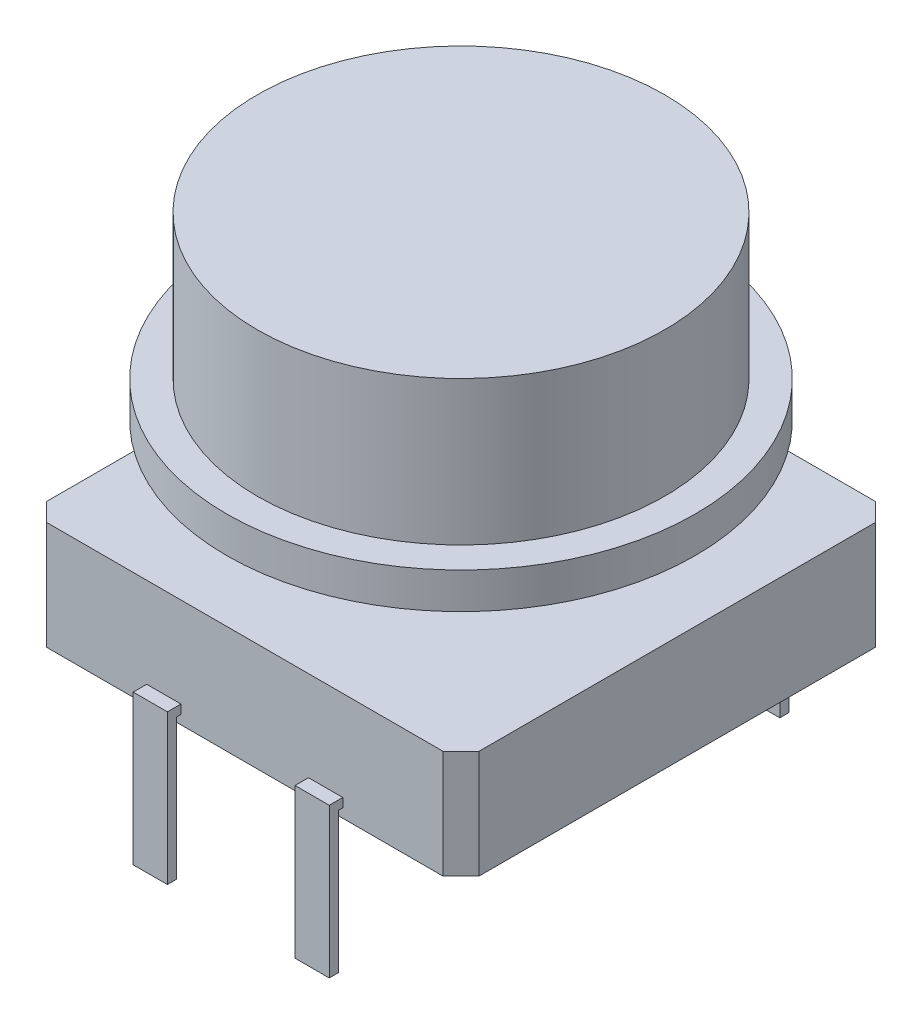
from build123d import *

# Parameters (mm, degrees)
BOSS_EXTRUDE1_DEPTH  = 3
SKETCH2_R            = 3.375
BOSS_EXTRUDE2_DEPTH  = 0.2
SKETCH3_W            = 3.5
SKETCH3_H            = 3.5
BOSS_EXTRUDE3_DEPTH  = 2
SKETCH4_R            = 6.5
BOSS_EXTRUDE4_DEPTH  = 1
SKETCH5_R            = 5.65
BOSS_EXTRUDE5_DEPTH  = 4
BOSS_EXTRUDE6_DEPTH  = 0.95
MIRROR2_COPY_1_DEPTH = 0.95


with BuildPart() as part:
    # Sketch1 → Boss-Extrude1 (new body)
    with BuildSketch(Plane(origin=(0, 0, 0), x_dir=(1, 0, 0), z_dir=(0, 1, 0))):
        Polygon((-5.5, 6), (-6, 5.5), (-6, -5.5), (-5.5, -6), (5.5, -6), (6, -5.5), (6, 5.5), (5.5, 6), align=None)
    extrude(amount=BOSS_EXTRUDE1_DEPTH)

    # Sketch2 → Boss-Extrude2 (add)
    with BuildSketch(Plane(origin=(0, 3, 0), x_dir=(1, 0, 0), z_dir=(0, 1, 0))):
        Circle(SKETCH2_R)
    extrude(amount=BOSS_EXTRUDE2_DEPTH)

    # Sketch3 → Boss-Extrude3 (add)
    with BuildSketch(Plane(origin=(0, 3.2, 0), x_dir=(1, 0, 0), z_dir=(0, 1, 0))):
        Rectangle(SKETCH3_W, SKETCH3_H)
    extrude(amount=BOSS_EXTRUDE3_DEPTH)

    # Sketch4 → Boss-Extrude4 (add)
    with BuildSketch(Plane(origin=(0, 5.2, 0), x_dir=(1, 0, 0), z_dir=(0, 1, 0))):
        Circle(SKETCH4_R)
    extrude(amount=BOSS_EXTRUDE4_DEPTH)

    # Sketch5 → Boss-Extrude5 (add)
    with BuildSketch(Plane(origin=(0, 6.2, 0), x_dir=(1, 0, 0), z_dir=(0, 1, 0))):
        Circle(SKETCH5_R)
    extrude(amount=BOSS_EXTRUDE5_DEPTH)

    # Sketch7 → Boss-Extrude6 (add)
    with BuildSketch(Plane.ZY.offset(2.72)):
        Polygon((6.375, 0.5), (6, 0.5), (6, 0.25), (6.125, 0.25), (6.125, -3.65), (6.375, -3.65), align=None)
    boss_extrude6 = extrude(amount=-BOSS_EXTRUDE6_DEPTH)

    # Mirror1: Boss-Extrude6 across plane
    add(boss_extrude6.mirror(Plane.ZY))

    # Mirror2: Boss-Extrude6 across plane
    add(boss_extrude6.mirror(Plane.XY))

    # Mirror2 copy 1 sketch → Mirror2 copy 1 (add)
    with BuildSketch(Plane(origin=(2.72, 0, 0), x_dir=(0, 0, -1), z_dir=(1, 0, 0))):
        Polygon((6.375, 0.5), (6, 0.5), (6, 0.25), (6.125, 0.25), (6.125, -3.65), (6.375, -3.65), align=None)
    extrude(amount=-MIRROR2_COPY_1_DEPTH)


solid = part.part
